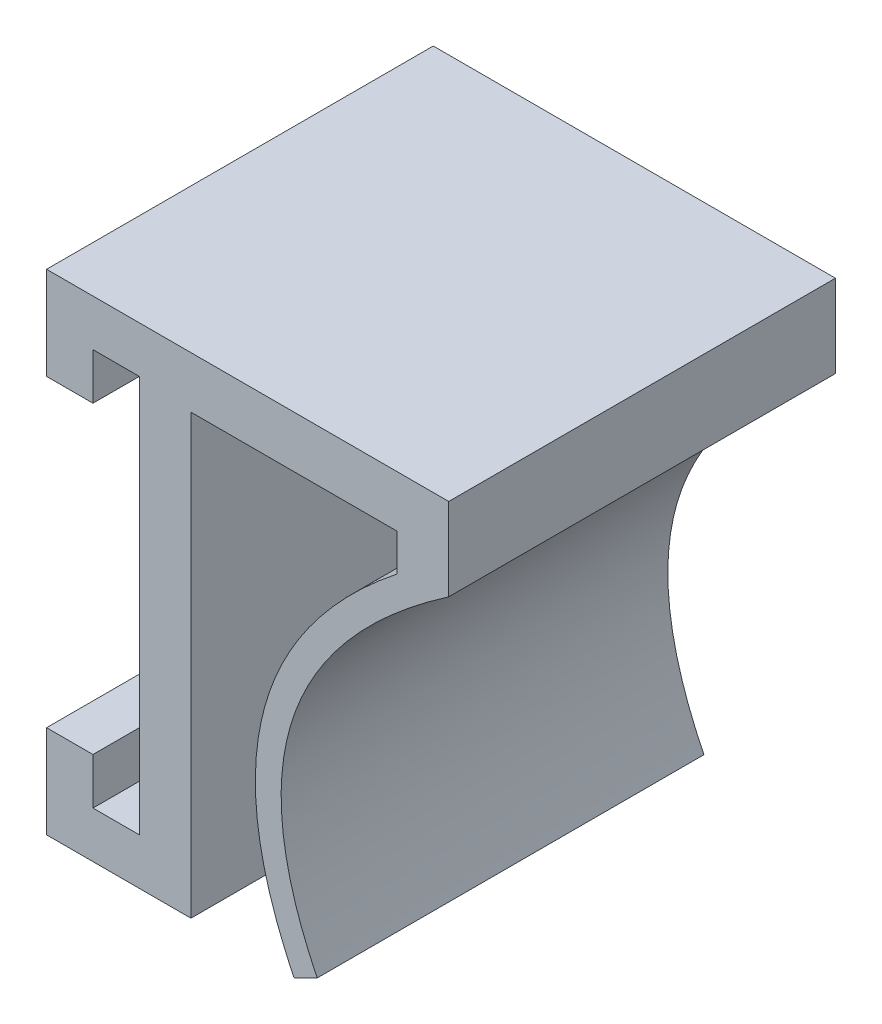
from build123d import *

# Parameters (mm, degrees)
AUFSATZ_LINEAR_AUSTRAGEN1_DEPTH = 15
SKIZZE8_W                       = 15
SKIZZE8_H                       = 1.8
AUFSATZ_LINEAR_AUSTRAGEN2_DEPTH = 3.6
SKIZZE9_W                       = 1.8
SKIZZE9_H                       = 15
AUFSATZ_LINEAR_AUSTRAGEN3_DEPTH = 1.8
SKIZZE10_W                      = 1.8
SKIZZE10_H                      = 15
AUFSATZ_LINEAR_AUSTRAGEN4_DEPTH = 1.8


# Read off the part's stored shape, not the designer's step: Aufsatz-Linear austragen1
with BuildPart() as part:
    # Aufsatz-Linear austragen1 outline → Aufsatz-Linear austragen1 (new body)
    with BuildSketch(Plane.XY):
        with BuildLine():
            Line((9, 7.5), (9, 6.063801072))
            add(Edge.make_bspline(
                [(9, 6.063801072), (0.625422786, -0.579708044), (5, -9.5)],
                knots=[0.099237207, 0.099237207, 0.099237207, 1, 1, 1], degree=2))
            Line((5, -9.5), (5.897845721, -9.059689812))
            add(Edge.make_bspline(
                [(11, 6.296359693), (10.760549258, 6.131767377), (10.109849177, 5.669537639), (8.781306837, 4.626115655), (7.217816891, 3.118827009), (5.842447746, 1.269563984), (4.939494511, -0.621982734), (4.487436221, -2.56912246), (4.473192517, -4.602736578), (4.838873177, -6.401075315), (5.360722545, -7.892341674), (5.712043828, -8.68082614), (5.897845721, -9.059689812)],
                knots=[0.026920818, 0.026920818, 0.026920818, 0.026920818, 0.0625, 0.125, 0.25, 0.375, 0.5, 0.625, 0.75, 0.875, 0.9375, 1, 1, 1, 1], degree=3))
            Line((11, 6.296359693), (11, 9.5))
            Line((11, 9.5), (-1, 9.5))
            Line((-1, 9.5), (-1, -9.5))
            Line((-1, -9.5), (1, -9.5))
            Line((1, -9.5), (1, 7.5))
            Line((1, 7.5), (9, 7.5))
        make_face()
    extrude(amount=AUFSATZ_LINEAR_AUSTRAGEN1_DEPTH)

    # Skizze8 → Aufsatz-Linear austragen2 (add)
    with BuildSketch(Plane.ZY.offset(1)):
        with Locations((7.5, 8.6)):
            Rectangle(SKIZZE8_W, SKIZZE8_H)
        with Locations((7.5, -8.6)):
            Rectangle(SKIZZE8_W, SKIZZE8_H)
    extrude(amount=AUFSATZ_LINEAR_AUSTRAGEN2_DEPTH)

    # Skizze9 → Aufsatz-Linear austragen3 (add)
    with BuildSketch(Plane(origin=(0, -7.7, 0), x_dir=(1, 0, 0), z_dir=(0, 1, 0))):
        with Locations((-3.7, -7.5)):
            Rectangle(SKIZZE9_W, SKIZZE9_H)
    extrude(amount=AUFSATZ_LINEAR_AUSTRAGEN3_DEPTH)

    # Skizze10 → Aufsatz-Linear austragen4 (add)
    with BuildSketch(Plane.XZ.offset(-7.7)):
        with Locations((-3.7, 7.5)):
            Rectangle(SKIZZE10_W, SKIZZE10_H)
    extrude(amount=AUFSATZ_LINEAR_AUSTRAGEN4_DEPTH)


solid = part.part
